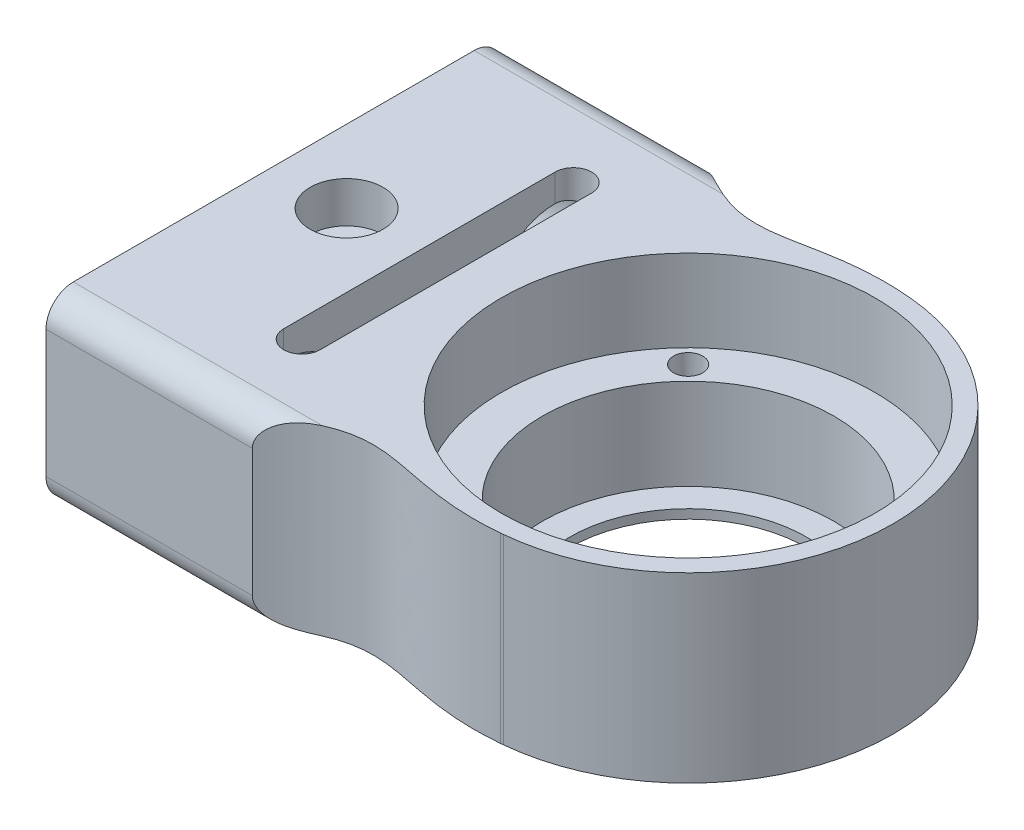
from build123d import *

# Parameters (mm, degrees)
EXTRUDE_1_DEPTH             = 20
SKETCH_2_R                  = 7
CUT_EXTRUDE_1_DEPTH         = 20
SKETCH_3_R                  = 13
CUT_EXTRUDE_2_DEPTH         = 87.740993769
SKETCH_4_R                  = 16
CUT_EXTRUDE_3_DEPTH         = 19
CUT_EXTRUDE_9_DEPTH         = 87.740993769
EXTRUDE_START               = -20
EXTRUDE_4_DEPTH             = 20
FILLET_2_R                  = 3
SKETCH_7_R                  = 20.5
CUT_EXTRUDE_10_DEPTH        = 9
SKETCH_8_W                  = 29.8
SKETCH_8_H                  = 4
CUT_EXTRUDE_11_DEPTH        = 20
CUT_EXTRUDE_12_DEPTH        = 10
HOLE_WIZARD_M41_D           = 4.3
HOLE_WIZARD_M41_DEPTH       = 8
HOLE_WIZARD_M41_CBORE_D     = 8
HOLE_WIZARD_M41_CBORE_DEPTH = 4.5
M4X0_71_D                   = 3.3
HOLE_WIZARD_M31_D           = 3.2


# Read off the part's stored shape, not the designer's step: Бобышка-Вытянуть4
with BuildPart() as part:
    # Эскиз1 → Бобышка-Вытянуть1 (new body)
    with BuildSketch(Plane(origin=(0, 0, 0), x_dir=(1, 0, 0), z_dir=(0, 1, 0))):
        with BuildLine():
            Line((0, 0), (0, 50))
            Line((0, 50), (20, 50))
            Line((20, 50), (47.60878471, 47.400960405))
            ThreePointArc((47.60878471, 47.400960405), (68, 25), (47.60878471, 2.599039595))
            Line((47.60878471, 2.599039595), (20, 0))
            Line((20, 0), (0, 0))
        make_face()
    extrude(amount=EXTRUDE_1_DEPTH)

    # Эскиз2 → Вырез-Вытянуть1 (cut)
    with BuildSketch(Plane.ZY):
        with Locations((-39.9, 10)):
            Circle(SKETCH_2_R)
        with Locations(Location((-10.1, 10, 0), (0, 0, 180))):
            Circle(SKETCH_2_R)
    extrude(amount=-CUT_EXTRUDE_1_DEPTH, mode=Mode.SUBTRACT)

    # Эскиз3 → Вырез-Вытянуть2 (cut, through all)
    with BuildSketch(Plane(origin=(0, 20, 0), x_dir=(1, 0, 0), z_dir=(0, 1, 0))):
        with Locations(Location((45.5, 25, 0), (0, 0, 270))):
            Circle(SKETCH_3_R)
    extrude(amount=-CUT_EXTRUDE_2_DEPTH, mode=Mode.SUBTRACT)

    # Эскиз4 → Вырез-Вытянуть3 (cut)
    with BuildSketch(Plane(origin=(0, 20, 0), x_dir=(1, 0, 0), z_dir=(0, 1, 0))):
        with Locations(Location((45.5, 25, 0), (0, 0, 270))):
            Circle(SKETCH_4_R)
    extrude(amount=-CUT_EXTRUDE_3_DEPTH, mode=Mode.SUBTRACT)

    # Эскиз5 → Вырез-Вытянуть9 (cut, through all)
    with BuildSketch(Plane(origin=(0, 20, 0), x_dir=(1, 0, 0), z_dir=(0, 1, 0))):
        with BuildLine():
            add(Edge.make_bspline(
                [(47.32108314, 47.428044097), (47.41641101, 47.41948544), (47.512308925, 47.410461109), (47.60878471, 47.400960405)],
                knots=[0.992066387, 0.992066387, 0.992066387, 0.992066387, 1, 1, 1, 1], degree=3))
            Line((47.32108314, 47.428044095), (47.60878471, 47.400960405))
        make_face()
        with BuildLine():
            Line((47.32108314, 47.428044097), (23, 49.717585585))
            add(Edge.make_bspline(
                [(23, 49.717585585), (32.393861284, 42.286998451), (35.400716473, 48.498269788), (47.32108314, 47.428044097)],
                knots=[0, 0, 0, 0, 0.992066387, 0.992066387, 0.992066387, 0.992066387], degree=3))
        make_face()
        with BuildLine():
            add(Edge.make_bspline(
                [(23, 0.282414415), (32.393861284, 7.713001549), (35.400716473, 1.501730212), (47.32108314, 2.571955903)],
                knots=[0, 0, 0, 0, 0.992066387, 0.992066387, 0.992066387, 0.992066387], degree=3))
            Line((23, 0.282414415), (47.32108314, 2.571955903))
        make_face()
        with BuildLine():
            Line((47.60878471, 2.599039595), (47.32108314, 2.571955905))
            add(Edge.make_bspline(
                [(47.32108314, 2.571955903), (47.41641101, 2.58051456), (47.512308925, 2.589538891), (47.60878471, 2.599039595)],
                knots=[0.992066387, 0.992066387, 0.992066387, 0.992066387, 1, 1, 1, 1], degree=3))
        make_face()
    extrude(amount=-CUT_EXTRUDE_9_DEPTH, mode=Mode.SUBTRACT)

    # Бобышка-Вытянуть4 outline → Бобышка-Вытянуть4 (add)
    with BuildSketch(Plane(origin=(0, 20, 0), x_dir=(1, 0, 0), z_dir=(0, 1, 0)).offset(EXTRUDE_START)):
        with BuildLine():
            add(Edge.make_bspline(
                [(22.6429674, 50), (22.761978267, 49.905861862), (22.880989133, 49.811723723), (23, 49.717585585)],
                knots=[-0.012568493, -0.012568493, -0.012568493, -0.012568493, 0, 0, 0, 0], degree=3))
            Line((22.6429674, 50), (20, 50))
            Line((20, 50), (23, 49.717585585))
        make_face()
        with BuildLine():
            Line((20, 0), (22.6479861, 0))
            add(Edge.make_bspline(
                [(22.6479861, 0), (22.766323231, 0.09625734), (22.883651508, 0.190382227), (23, 0.282414415)],
                knots=[-0.012287325, -0.012287325, -0.012287325, -0.012287325, 0, 0, 0, 0], degree=3))
            Line((23, 0.282414415), (20, 0))
        make_face()
    extrude(amount=EXTRUDE_4_DEPTH)

    # Скругление2
    fillet_2_edges = [part.edges().sort_by_distance(p)[0] for p in [
        (11.32399305, 0, 0),
        (11.32399305, 20, 0),
        (11.3214837, 0, -50),
        (11.3214837, 20, -50),
    ]]
    fillet(fillet_2_edges, radius=FILLET_2_R)

    # Эскиз7 → Вырез-Вытянуть10 (cut)
    with BuildSketch(Plane(origin=(0, 20, 0), x_dir=(1, 0, 0), z_dir=(0, 1, 0))):
        with Locations(Location((45.5, 25, 0), (0, 0, 270))):
            Circle(SKETCH_7_R)
    extrude(amount=-CUT_EXTRUDE_10_DEPTH, mode=Mode.SUBTRACT)

    # Эскиз8 → Вырез-Вытянуть11 (cut)
    with BuildSketch(Plane.ZY):
        with Locations((-25, 10)):
            Rectangle(SKETCH_8_W, SKETCH_8_H)
    extrude(amount=-CUT_EXTRUDE_11_DEPTH, mode=Mode.SUBTRACT)

    # Эскиз9 → Вырез-Вытянуть12 (cut)
    with BuildSketch(Plane(origin=(0, 20, 0), x_dir=(1, 0, 0), z_dir=(0, 1, 0))):
        with BuildLine():
            Line((20, 39.9), (20, 10.1))
            ThreePointArc((20, 10.1), (18, 8.1), (16, 10.1))
            Line((16, 10.1), (16, 39.9))
            ThreePointArc((16, 39.9), (18, 41.9), (20, 39.9))
        make_face()
    extrude(amount=-CUT_EXTRUDE_12_DEPTH, mode=Mode.SUBTRACT)

    # Цековка для винта с внутренним шестигранником M41
    with Locations(Plane(origin=(0, 20, 0), x_dir=(1, 0, 0), z_dir=(0, 1, 0))):
        with Locations((8, 25)):
            CounterBoreHole(HOLE_WIZARD_M41_D / 2, HOLE_WIZARD_M41_CBORE_D / 2, HOLE_WIZARD_M41_CBORE_DEPTH, depth=HOLE_WIZARD_M41_DEPTH)

    # Отверстие обработанное метчиком M4x0.71 (through all)
    with Locations(Plane(origin=(0, 8, 0), x_dir=(1, 0, 0), z_dir=(0, 1, 0))):
        with Locations((8, 25)):
            Hole(M4X0_71_D / 2)

    # Отверстие с зазором M31 (through all)
    with Locations(Plane(origin=(0, 11, 0), x_dir=(1, 0, 0), z_dir=(0, 1, 0))):
        with Locations((32.595301243, 37.904698757), (58.404698757, 37.904698757), (58.404698757, 12.095301243), (32.595301243, 12.095301243)):
            Hole(HOLE_WIZARD_M31_D / 2)


solid = part.part
